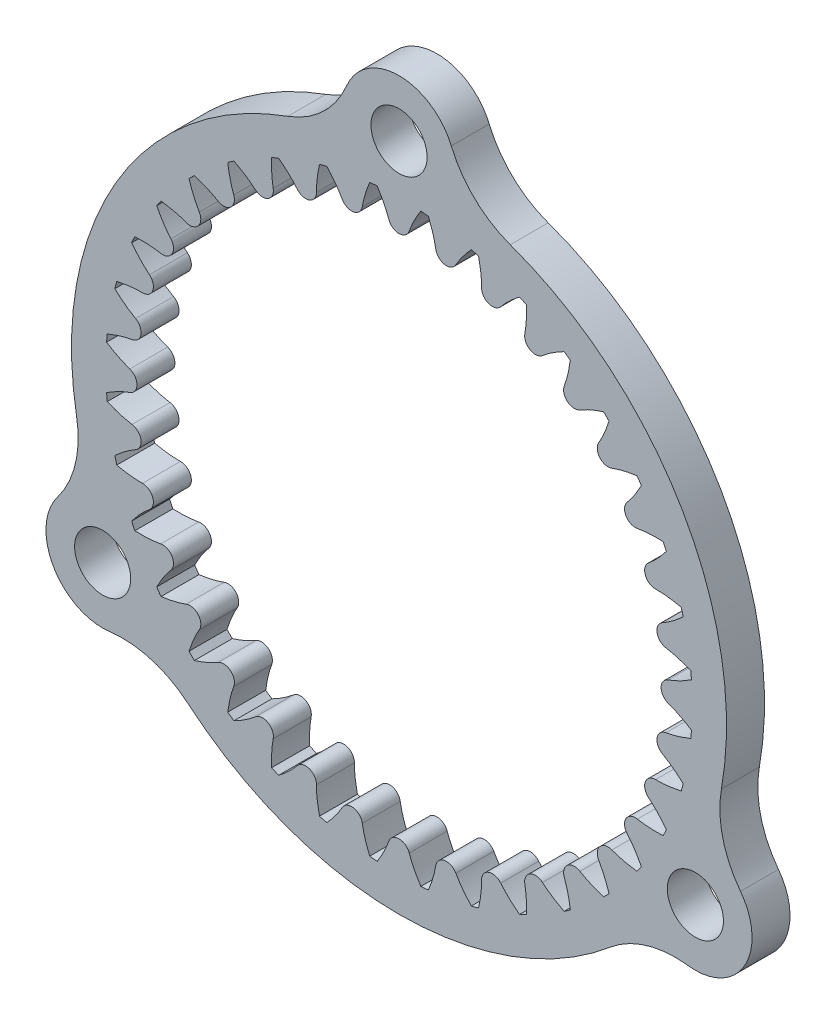
from build123d import *

# Parameters (mm, degrees)
SKETCH_1_R               = 36.406666664
SKETCH_1_R_2             = 32.59666666
EXTRUDE_1_DEPTH          = 4.22
EXTRUDE_2_DEPTH          = 4.22
PATTERN_CIRCULAR_1_COUNT = 36
FILLET_START             = -1
FILLET_1_DEPTH           = 6
PATTERN_CIRCULAR_2_COUNT = 36
EXTRUDE_3_DEPTH          = 4.22
FILLET_2_R               = 1.2
PATTERN_CIRCULAR_4_DEPTH = 4.22
PATTERN_CIRCULAR_8_COUNT = 3
SKETCH_5_R               = 3.12
CUT_EXTRUDE_1_DEPTH      = 10
PATTERN_CIRCULAR_9_COUNT = 3


with BuildPart() as part:
    # 草图1 → 凸台-拉伸1 (new body)
    with BuildSketch(Plane.XY):
        Circle(SKETCH_1_R)
        Circle(SKETCH_1_R_2, mode=Mode.SUBTRACT)
    extrude(amount=EXTRUDE_1_DEPTH)

    # 草图2 → 凸台-拉伸2 (add)
    with BuildSketch(Plane.XY):
        with BuildLine():
            ThreePointArc((0.836501753, 28.773540843), (0, 28.785697626), (-0.836501753, 28.773540843))
            add(Edge.make_bspline(
                [(-0.836501753, 28.773540843), (-0.846188353, 28.847595209), (-0.863798792, 28.953372202), (-0.89226802, 29.094073507), (-0.916024471, 29.200502204), (-0.944616842, 29.317566037), (-0.978480269, 29.445109526), (-1.01804375, 29.582964293), (-1.063732113, 29.730948947), (-1.115964959, 29.888869273), (-1.175156536, 30.056518351), (-1.241715329, 30.233676694), (-1.31604375, 30.420112401), (-1.398537793, 30.615581311), (-1.48958671, 30.819827171), (-1.589572688, 31.032581808), (-1.698870525, 31.25356531), (-1.817847315, 31.482486219), (-1.946862133, 31.719041726), (-2.086265761, 31.962917879), (-2.236400245, 32.213789796), (-2.455384739, 32.563640354), (-2.630772095, 32.825693461), (-2.753198749, 33.001206032)],
                knots=[0, 0, 0, 0, 0.04787327, 0.068728366, 0.09203189, 0.11778384, 0.145984218, 0.176633023, 0.209730255, 0.245275915, 0.283270001, 0.323712515, 0.366603456, 0.411942824, 0.459730619, 0.509966842, 0.562651491, 0.617784568, 0.675366072, 0.735396003, 0.797874362, 0.862801147, 1, 1, 1, 1], degree=3))
            ThreePointArc((-2.753198749, 33.001206032), (0, 33.115852743), (2.753198749, 33.001206032))
            add(Edge.make_bspline(
                [(0.836501753, 28.773540843), (0.846188353, 28.847595209), (0.863798792, 28.953372202), (0.89226802, 29.094073507), (0.916024471, 29.200502204), (0.944616842, 29.317566037), (0.978480269, 29.445109526), (1.01804375, 29.582964293), (1.063732113, 29.730948947), (1.115964959, 29.888869273), (1.175156536, 30.056518351), (1.241715329, 30.233676694), (1.31604375, 30.420112401), (1.398537793, 30.615581311), (1.48958671, 30.819827171), (1.589572688, 31.032581808), (1.698870525, 31.25356531), (1.817847315, 31.482486219), (1.946862133, 31.719041726), (2.086265761, 31.962917879), (2.236400245, 32.213789796), (2.455384739, 32.563640354), (2.630772095, 32.825693461), (2.753198749, 33.001206032)],
                knots=[0, 0, 0, 0, 0.04787327, 0.068728366, 0.09203189, 0.11778384, 0.145984218, 0.176633023, 0.209730255, 0.245275915, 0.283270001, 0.323712515, 0.366603456, 0.411942824, 0.459730619, 0.509966842, 0.562651491, 0.617784568, 0.675366072, 0.735396003, 0.797874362, 0.862801147, 1, 1, 1, 1], degree=3))
        make_face()
    extrude_2 = extrude(amount=EXTRUDE_2_DEPTH)

    # 阵列(圆周)1: 凸台-拉伸2 ×36 about axis
    pattern_circular_1_axis = Axis((0, 0, -0.211), (0, 0, 1))
    for i in range(1, PATTERN_CIRCULAR_1_COUNT):
        add(extrude_2.rotate(pattern_circular_1_axis, i * 360 / PATTERN_CIRCULAR_1_COUNT))

    # 圆角1: read off the stored shape, not the designer's step
    # 圆角1 outline → 圆角1 (cut)
    with BuildSketch(Plane.XY.offset(FILLET_START)):
        with BuildLine():
            ThreePointArc((-9.171394645, 28.387186586), (-9.343286246, 27.645141537), (-9.857475998, 27.083192718))
            ThreePointArc((-9.857475998, 27.083192718), (-10.612581938, 27.183155687), (-11.221235907, 27.641105381))
            add(Edge.make_bspline(
                [(-11.221235907, 27.641105381), (-11.202780791, 27.617765636), (-11.152648486, 27.55366216), (-11.074617887, 27.450701778), (-10.990291269, 27.334692178), (-10.914847613, 27.226422476), (-10.847941385, 27.126197623), (-10.789216865, 27.034312547), (-10.714341861, 26.911833618), (-10.661615599, 26.818458884), (-10.627185088, 26.752183555)],
                knots=[0.771193123, 0.771193123, 0.771193123, 0.771193123, 0.790269745, 0.823366977, 0.854015782, 0.88221616, 0.90796811, 0.931271634, 0.95212673, 1, 1, 1, 1], degree=3))
            ThreePointArc((-10.627185088, 26.752183555), (-9.845288428, 27.049707644), (-9.055076038, 27.324384454))
            add(Edge.make_bspline(
                [(-9.055076038, 27.324384454), (-9.071301697, 27.397285808), (-9.09093116, 27.502706791), (-9.112301516, 27.64465982), (-9.126378513, 27.752795265), (-9.139548662, 27.872578452), (-9.151349892, 28.004012102), (-9.161321488, 28.147084717), (-9.16772824, 28.276114047), (-9.170529586, 28.357444584), (-9.171394645, 28.387186586)],
                knots=[0, 0, 0, 0, 0.04787327, 0.068728366, 0.09203189, 0.11778384, 0.145984218, 0.176633023, 0.209730255, 0.228806877, 0.228806877, 0.228806877, 0.228806877], degree=3))
        make_face()
    fillet_1 = extrude(amount=FILLET_1_DEPTH, mode=Mode.SUBTRACT)

    # 阵列(圆周)2: 圆角1 ×36 about axis
    pattern_circular_2_axis = Axis((0, 0, 0), (0, 0, 1))
    for i in range(1, PATTERN_CIRCULAR_2_COUNT):
        add(fillet_1.rotate(pattern_circular_2_axis, i * 360 / PATTERN_CIRCULAR_2_COUNT), mode=Mode.SUBTRACT)

    # 草图4 → 凸台-拉伸3 (add)
    with BuildSketch(Plane.XY):
        with BuildLine():
            Line((-12.36497116, 34.242559276), (12.36497116, 34.242559276))
            ThreePointArc((12.36497116, 34.242559276), (8.43368382, 36.671147978), (5.810309696, 40.475220984))
            ThreePointArc((5.810309696, 40.475220984), (0, 44.34), (-5.810309696, 40.475220984))
            ThreePointArc((-5.810309696, 40.475220984), (-8.43368382, 36.671147978), (-12.36497116, 34.242559276))
        make_face()
    extrude_3 = extrude(amount=EXTRUDE_3_DEPTH)

    # 圆角2
    fillet_2_edges = [part.edges().sort_by_distance(p)[0] for p in [
        (-9.857475998, 27.083192718, 2.11),
    ]]
    fillet(fillet_2_edges, radius=FILLET_2_R)

    # 阵列(圆周)4: read off the stored shape, not the designer's step
    # 阵列(圆周)4 outline → 阵列(圆周)4 (cut)
    with BuildSketch(Plane.XY):
        with BuildLine():
            add(Edge.make_bspline(
                [(6.250932542, 29.169722048), (6.263124066, 29.192332015), (6.284161309, 29.230918999), (6.305493149, 29.269343531), (6.314406497, 29.285281571)],
                knots=[0.228806877, 0.228806877, 0.228806877, 0.228806877, 0.245275915, 0.256983722, 0.256983722, 0.256983722, 0.256983722], degree=3))
            ThreePointArc((6.314406497, 29.285281571), (5.058686752, 28.689238209), (4.082555011, 29.678817205))
            add(Edge.make_bspline(
                [(4.082555011, 29.678817205), (4.085479688, 29.660791802), (4.092383096, 29.617388634), (4.098954112, 29.573933569), (4.102677333, 29.548517403)],
                knots=[0.743016278, 0.743016278, 0.743016278, 0.743016278, 0.754724085, 0.771193123, 0.771193123, 0.771193123, 0.771193123], degree=3))
            ThreePointArc((4.102677333, 29.548517403), (4.400812285, 28.847594349), (5.004771727, 28.383470908))
            ThreePointArc((5.004771727, 28.383470908), (5.731047524, 28.613037986), (6.250932542, 29.169722048))
        make_face()
        with BuildLine():
            add(Edge.make_bspline(
                [(11.221235907, 27.641105381), (11.237168394, 27.661254817), (11.264586594, 27.695602499), (11.292266705, 27.729739041), (11.303812251, 27.743887159)],
                knots=[0.228806877, 0.228806877, 0.228806877, 0.228806877, 0.245275915, 0.256983722, 0.256983722, 0.256983722, 0.256983722], degree=3))
            ThreePointArc((11.303812251, 27.743887159), (9.963667868, 27.374952481), (9.17420435, 28.519001046))
            add(Edge.make_bspline(
                [(9.17420435, 28.519001046), (9.173954516, 28.500741625), (9.173216164, 28.456799084), (9.17214146, 28.412863154), (9.171394645, 28.387186586)],
                knots=[0.743016278, 0.743016278, 0.743016278, 0.743016278, 0.754724085, 0.771193123, 0.771193123, 0.771193123, 0.771193123], degree=3))
            ThreePointArc((9.171394645, 28.387186586), (9.343286246, 27.645141537), (9.857475998, 27.083192718))
            ThreePointArc((9.857475998, 27.083192718), (10.612581938, 27.183155687), (11.221235907, 27.641105381))
        make_face()
        with BuildLine():
            add(Edge.make_bspline(
                [(15.850587698, 25.272627715), (15.869777047, 25.289704388), (15.902743116, 25.318769131), (15.935930452, 25.347580461), (15.94975739, 25.359508775)],
                knots=[0.228806877, 0.228806877, 0.228806877, 0.228806877, 0.245275915, 0.256983722, 0.256983722, 0.256983722, 0.256983722], degree=3))
            ThreePointArc((15.94975739, 25.359508775), (14.565907976, 25.228892673), (13.987100132, 26.492649472))
            add(Edge.make_bspline(
                [(13.987100132, 26.492649472), (13.983683378, 26.474710835), (13.975325702, 26.431564094), (13.96663793, 26.388482269), (13.961443772, 26.363325469)],
                knots=[0.743016278, 0.743016278, 0.743016278, 0.743016278, 0.754724085, 0.771193123, 0.771193123, 0.771193123, 0.771193123], degree=3))
            ThreePointArc((13.961443772, 26.363325469), (14.001869183, 25.602705089), (14.410665849, 24.960005421))
            ThreePointArc((14.410665849, 24.960005421), (15.171658421, 24.927326958), (15.850587698, 25.272627715))
        make_face()
        with BuildLine():
            add(Edge.make_bspline(
                [(19.998327403, 22.136254044), (20.020190555, 22.149739088), (20.057702835, 22.172637775), (20.095389016, 22.195248476), (20.111077222, 22.204594549)],
                knots=[0.228806877, 0.228806877, 0.228806877, 0.228806877, 0.245275915, 0.256983722, 0.256983722, 0.256983722, 0.256983722], degree=3))
            ThreePointArc((20.111077222, 22.204594549), (18.725570342, 22.316265728), (18.375004954, 23.661332149))
            add(Edge.make_bspline(
                [(18.375004954, 23.661332149), (18.368525097, 23.644259353), (18.35280204, 23.603219403), (18.336765175, 23.562300704), (18.327281495, 23.538428048)],
                knots=[0.743016278, 0.743016278, 0.743016278, 0.743016278, 0.754724085, 0.771193123, 0.771193123, 0.771193123, 0.771193123], degree=3))
            ThreePointArc((18.327281495, 23.538428048), (18.23501241, 22.782343402), (18.52599491, 22.078420991))
            ThreePointArc((18.52599491, 22.078420991), (19.269751739, 21.914094013), (19.998327403, 22.136254044))
        make_face()
        with BuildLine():
            add(Edge.make_bspline(
                [(23.538428048, 18.327281495), (23.562300704, 18.336765175), (23.603219403, 18.35280204), (23.644259353, 18.368525097), (23.661332149, 18.375004954)],
                knots=[0.228806877, 0.228806877, 0.228806877, 0.228806877, 0.245275915, 0.256983722, 0.256983722, 0.256983722, 0.256983722], degree=3))
            ThreePointArc((23.661332149, 18.375004954), (22.316265728, 18.725570342), (22.204594549, 20.111077222))
            add(Edge.make_bspline(
                [(22.204594549, 20.111077222), (22.195248476, 20.095389016), (22.172637775, 20.057702835), (22.149739088, 20.020190555), (22.136254044, 19.998327403)],
                knots=[0.743016278, 0.743016278, 0.743016278, 0.743016278, 0.754724085, 0.771193123, 0.771193123, 0.771193123, 0.771193123], degree=3))
            ThreePointArc((22.136254044, 19.998327403), (21.914094013, 19.269751739), (22.078420991, 18.52599491))
            ThreePointArc((22.078420991, 18.52599491), (22.782343402, 18.23501241), (23.538428048, 18.327281495))
        make_face()
        with BuildLine():
            add(Edge.make_bspline(
                [(26.363325469, 13.961443772), (26.388482269, 13.96663793), (26.431564094, 13.975325702), (26.474710835, 13.983683378), (26.492649472, 13.987100132)],
                knots=[0.228806877, 0.228806877, 0.228806877, 0.228806877, 0.245275915, 0.256983722, 0.256983722, 0.256983722, 0.256983722], degree=3))
            ThreePointArc((26.492649472, 13.987100132), (25.228892673, 14.565907976), (25.359508775, 15.94975739))
            add(Edge.make_bspline(
                [(25.359508775, 15.94975739), (25.347580461, 15.935930452), (25.318769131, 15.902743116), (25.289704388, 15.869777047), (25.272627715, 15.850587698)],
                knots=[0.743016278, 0.743016278, 0.743016278, 0.743016278, 0.754724085, 0.771193123, 0.771193123, 0.771193123, 0.771193123], degree=3))
            ThreePointArc((25.272627715, 15.850587698), (24.927326958, 15.171658421), (24.960005421, 14.410665849))
            ThreePointArc((24.960005421, 14.410665849), (25.602705089, 14.001869183), (26.363325469, 13.961443772))
        make_face()
        with BuildLine():
            add(Edge.make_bspline(
                [(28.387186586, 9.171394645), (28.412863154, 9.17214146), (28.456799084, 9.173216164), (28.500741625, 9.173954516), (28.519001046, 9.17420435)],
                knots=[0.228806877, 0.228806877, 0.228806877, 0.228806877, 0.245275915, 0.256983722, 0.256983722, 0.256983722, 0.256983722], degree=3))
            ThreePointArc((28.519001046, 9.17420435), (27.374952481, 9.963667868), (27.743887159, 11.303812251))
            add(Edge.make_bspline(
                [(27.743887159, 11.303812251), (27.729739041, 11.292266705), (27.695602499, 11.264586594), (27.661254816, 11.237168394), (27.641105381, 11.221235907)],
                knots=[0.743016278, 0.743016278, 0.743016278, 0.743016278, 0.754724085, 0.771193123, 0.771193123, 0.771193123, 0.771193123], degree=3))
            ThreePointArc((27.641105381, 11.221235907), (27.183155687, 10.612581938), (27.083192718, 9.857475998))
            ThreePointArc((27.083192718, 9.857475998), (27.645141537, 9.343286246), (28.387186586, 9.171394645))
        make_face()
        with BuildLine():
            add(Edge.make_bspline(
                [(29.548517403, 4.102677333), (29.573933569, 4.098954112), (29.617388634, 4.092383096), (29.660791802, 4.085479688), (29.678817205, 4.082555011)],
                knots=[0.228806877, 0.228806877, 0.228806877, 0.228806877, 0.245275915, 0.256983722, 0.256983722, 0.256983722, 0.256983722], degree=3))
            ThreePointArc((29.678817205, 4.082555011), (28.689238209, 5.058686752), (29.285281571, 6.314406497))
            add(Edge.make_bspline(
                [(29.285281571, 6.314406497), (29.269343531, 6.305493149), (29.230918999, 6.284161309), (29.192332015, 6.263124066), (29.169722048, 6.250932542)],
                knots=[0.743016278, 0.743016278, 0.743016278, 0.743016278, 0.754724085, 0.771193123, 0.771193123, 0.771193123, 0.771193123], degree=3))
            ThreePointArc((29.169722048, 6.250932542), (28.613037986, 5.731047524), (28.383470908, 5.004771727))
            ThreePointArc((28.383470908, 5.004771727), (28.847594349, 4.400812285), (29.548517403, 4.102677333))
        make_face()
        with BuildLine():
            add(Edge.make_bspline(
                [(29.812031471, -1.090697754), (29.836414978, -1.098777882), (29.878068818, -1.112794963), (29.91961383, -1.127130374), (29.936857522, -1.133140697)],
                knots=[0.228806877, 0.228806877, 0.228806877, 0.228806877, 0.245275915, 0.256983722, 0.256983722, 0.256983722, 0.256983722], degree=3))
            ThreePointArc((29.936857522, -1.133140697), (29.131815952, 0), (29.936857522, 1.133140697))
            add(Edge.make_bspline(
                [(29.936857522, 1.133140697), (29.91961383, 1.127130374), (29.878068818, 1.112794963), (29.836414978, 1.098777882), (29.812031471, 1.090697754)],
                knots=[0.743016278, 0.743016278, 0.743016278, 0.743016278, 0.754724085, 0.771193123, 0.771193123, 0.771193123, 0.771193123], degree=3))
            ThreePointArc((29.812031471, 1.090697754), (29.173527604, 0.675378131), (28.821331698, 0))
            ThreePointArc((28.821331698, 0), (29.173527604, -0.675378131), (29.812031471, -1.090697754))
        make_face()
        with BuildLine():
            add(Edge.make_bspline(
                [(29.169722048, -6.250932542), (29.192332015, -6.263124066), (29.230918999, -6.284161309), (29.269343531, -6.305493149), (29.285281571, -6.314406497)],
                knots=[0.228806877, 0.228806877, 0.228806877, 0.228806877, 0.245275915, 0.256983722, 0.256983722, 0.256983722, 0.256983722], degree=3))
            ThreePointArc((29.285281571, -6.314406497), (28.689238209, -5.058686752), (29.678817205, -4.082555011))
            add(Edge.make_bspline(
                [(29.678817205, -4.082555011), (29.660791802, -4.085479688), (29.617388634, -4.092383096), (29.573933569, -4.098954112), (29.548517403, -4.102677333)],
                knots=[0.743016278, 0.743016278, 0.743016278, 0.743016278, 0.754724085, 0.771193123, 0.771193123, 0.771193123, 0.771193123], degree=3))
            ThreePointArc((29.548517403, -4.102677333), (28.847594349, -4.400812285), (28.383470908, -5.004771727))
            ThreePointArc((28.383470908, -5.004771727), (28.613037986, -5.731047524), (29.169722048, -6.250932542))
        make_face()
        with BuildLine():
            add(Edge.make_bspline(
                [(27.641105381, -11.221235907), (27.661254817, -11.237168394), (27.695602499, -11.264586594), (27.729739041, -11.292266705), (27.743887159, -11.303812251)],
                knots=[0.228806877, 0.228806877, 0.228806877, 0.228806877, 0.245275915, 0.256983722, 0.256983722, 0.256983722, 0.256983722], degree=3))
            ThreePointArc((27.743887159, -11.303812251), (27.374952481, -9.963667868), (28.519001046, -9.17420435))
            add(Edge.make_bspline(
                [(28.519001046, -9.17420435), (28.500741625, -9.173954516), (28.456799084, -9.173216164), (28.412863154, -9.17214146), (28.387186586, -9.171394645)],
                knots=[0.743016278, 0.743016278, 0.743016278, 0.743016278, 0.754724085, 0.771193123, 0.771193123, 0.771193123, 0.771193123], degree=3))
            ThreePointArc((28.387186586, -9.171394645), (27.645141537, -9.343286246), (27.083192718, -9.857475998))
            ThreePointArc((27.083192718, -9.857475998), (27.183155687, -10.612581938), (27.641105381, -11.221235907))
        make_face()
        with BuildLine():
            add(Edge.make_bspline(
                [(25.272627715, -15.850587698), (25.289704388, -15.869777047), (25.318769131, -15.902743116), (25.347580461, -15.935930452), (25.359508775, -15.94975739)],
                knots=[0.228806877, 0.228806877, 0.228806877, 0.228806877, 0.245275915, 0.256983722, 0.256983722, 0.256983722, 0.256983722], degree=3))
            ThreePointArc((25.359508775, -15.94975739), (25.228892673, -14.565907976), (26.492649472, -13.987100132))
            add(Edge.make_bspline(
                [(26.492649472, -13.987100132), (26.474710835, -13.983683378), (26.431564094, -13.975325702), (26.388482269, -13.96663793), (26.363325469, -13.961443772)],
                knots=[0.743016278, 0.743016278, 0.743016278, 0.743016278, 0.754724085, 0.771193123, 0.771193123, 0.771193123, 0.771193123], degree=3))
            ThreePointArc((26.363325469, -13.961443772), (25.602705089, -14.001869183), (24.960005421, -14.410665849))
            ThreePointArc((24.960005421, -14.410665849), (24.927326958, -15.171658421), (25.272627715, -15.850587698))
        make_face()
        with BuildLine():
            add(Edge.make_bspline(
                [(22.136254044, -19.998327403), (22.149739088, -20.020190555), (22.172637775, -20.057702835), (22.195248476, -20.095389016), (22.204594549, -20.111077222)],
                knots=[0.228806877, 0.228806877, 0.228806877, 0.228806877, 0.245275915, 0.256983722, 0.256983722, 0.256983722, 0.256983722], degree=3))
            ThreePointArc((22.204594549, -20.111077222), (22.316265728, -18.725570342), (23.661332149, -18.375004954))
            add(Edge.make_bspline(
                [(23.661332149, -18.375004954), (23.644259353, -18.368525097), (23.603219403, -18.35280204), (23.562300704, -18.336765175), (23.538428048, -18.327281495)],
                knots=[0.743016278, 0.743016278, 0.743016278, 0.743016278, 0.754724085, 0.771193123, 0.771193123, 0.771193123, 0.771193123], degree=3))
            ThreePointArc((23.538428048, -18.327281495), (22.782343402, -18.23501241), (22.078420991, -18.52599491))
            ThreePointArc((22.078420991, -18.52599491), (21.914094013, -19.269751739), (22.136254044, -19.998327403))
        make_face()
        with BuildLine():
            add(Edge.make_bspline(
                [(18.327281495, -23.538428048), (18.336765175, -23.562300704), (18.35280204, -23.603219403), (18.368525097, -23.644259353), (18.375004954, -23.661332149)],
                knots=[0.228806877, 0.228806877, 0.228806877, 0.228806877, 0.245275915, 0.256983722, 0.256983722, 0.256983722, 0.256983722], degree=3))
            ThreePointArc((18.375004954, -23.661332149), (18.725570342, -22.316265728), (20.111077222, -22.204594549))
            add(Edge.make_bspline(
                [(20.111077222, -22.204594549), (20.095389016, -22.195248476), (20.057702835, -22.172637775), (20.020190555, -22.149739088), (19.998327403, -22.136254044)],
                knots=[0.743016278, 0.743016278, 0.743016278, 0.743016278, 0.754724085, 0.771193123, 0.771193123, 0.771193123, 0.771193123], degree=3))
            ThreePointArc((19.998327403, -22.136254044), (19.269751739, -21.914094013), (18.52599491, -22.078420991))
            ThreePointArc((18.52599491, -22.078420991), (18.23501241, -22.782343402), (18.327281495, -23.538428048))
        make_face()
        with BuildLine():
            add(Edge.make_bspline(
                [(13.961443772, -26.363325469), (13.96663793, -26.388482269), (13.975325702, -26.431564094), (13.983683378, -26.474710835), (13.987100132, -26.492649472)],
                knots=[0.228806877, 0.228806877, 0.228806877, 0.228806877, 0.245275915, 0.256983722, 0.256983722, 0.256983722, 0.256983722], degree=3))
            ThreePointArc((13.987100132, -26.492649472), (14.565907976, -25.228892673), (15.94975739, -25.359508775))
            add(Edge.make_bspline(
                [(15.94975739, -25.359508775), (15.935930452, -25.347580461), (15.902743116, -25.318769131), (15.869777047, -25.289704388), (15.850587698, -25.272627715)],
                knots=[0.743016278, 0.743016278, 0.743016278, 0.743016278, 0.754724085, 0.771193123, 0.771193123, 0.771193123, 0.771193123], degree=3))
            ThreePointArc((15.850587698, -25.272627715), (15.171658421, -24.927326958), (14.410665849, -24.960005421))
            ThreePointArc((14.410665849, -24.960005421), (14.001869183, -25.602705089), (13.961443772, -26.363325469))
        make_face()
        with BuildLine():
            add(Edge.make_bspline(
                [(9.171394645, -28.387186586), (9.17214146, -28.412863154), (9.173216164, -28.456799084), (9.173954516, -28.500741625), (9.17420435, -28.519001046)],
                knots=[0.228806877, 0.228806877, 0.228806877, 0.228806877, 0.245275915, 0.256983722, 0.256983722, 0.256983722, 0.256983722], degree=3))
            ThreePointArc((9.17420435, -28.519001046), (9.963667868, -27.374952481), (11.303812251, -27.743887159))
            add(Edge.make_bspline(
                [(11.303812251, -27.743887159), (11.292266705, -27.729739041), (11.264586594, -27.695602499), (11.237168394, -27.661254816), (11.221235907, -27.641105381)],
                knots=[0.743016278, 0.743016278, 0.743016278, 0.743016278, 0.754724085, 0.771193123, 0.771193123, 0.771193123, 0.771193123], degree=3))
            ThreePointArc((11.221235907, -27.641105381), (10.612581938, -27.183155687), (9.857475998, -27.083192718))
            ThreePointArc((9.857475998, -27.083192718), (9.343286246, -27.645141537), (9.171394645, -28.387186586))
        make_face()
        with BuildLine():
            add(Edge.make_bspline(
                [(4.102677333, -29.548517403), (4.098954112, -29.573933569), (4.092383096, -29.617388634), (4.085479688, -29.660791802), (4.082555011, -29.678817205)],
                knots=[0.228806877, 0.228806877, 0.228806877, 0.228806877, 0.245275915, 0.256983722, 0.256983722, 0.256983722, 0.256983722], degree=3))
            ThreePointArc((4.082555011, -29.678817205), (5.058686752, -28.689238209), (6.314406497, -29.285281571))
            add(Edge.make_bspline(
                [(6.314406497, -29.285281571), (6.305493149, -29.269343531), (6.284161309, -29.230918999), (6.263124066, -29.192332015), (6.250932542, -29.169722048)],
                knots=[0.743016278, 0.743016278, 0.743016278, 0.743016278, 0.754724085, 0.771193123, 0.771193123, 0.771193123, 0.771193123], degree=3))
            ThreePointArc((6.250932542, -29.169722048), (5.731047524, -28.613037986), (5.004771727, -28.383470908))
            ThreePointArc((5.004771727, -28.383470908), (4.400812285, -28.847594349), (4.102677333, -29.548517403))
        make_face()
        with BuildLine():
            add(Edge.make_bspline(
                [(-1.090697754, -29.812031471), (-1.098777882, -29.836414978), (-1.112794963, -29.878068818), (-1.127130374, -29.91961383), (-1.133140697, -29.936857522)],
                knots=[0.228806877, 0.228806877, 0.228806877, 0.228806877, 0.245275915, 0.256983722, 0.256983722, 0.256983722, 0.256983722], degree=3))
            ThreePointArc((-1.133140697, -29.936857522), (0, -29.131815952), (1.133140697, -29.936857522))
            add(Edge.make_bspline(
                [(1.133140697, -29.936857522), (1.127130374, -29.91961383), (1.112794963, -29.878068818), (1.098777882, -29.836414978), (1.090697754, -29.812031471)],
                knots=[0.743016278, 0.743016278, 0.743016278, 0.743016278, 0.754724085, 0.771193123, 0.771193123, 0.771193123, 0.771193123], degree=3))
            ThreePointArc((1.090697754, -29.812031471), (0.675378131, -29.173527604), (0, -28.821331698))
            ThreePointArc((0, -28.821331698), (-0.675378131, -29.173527604), (-1.090697754, -29.812031471))
        make_face()
        with BuildLine():
            add(Edge.make_bspline(
                [(-6.250932542, -29.169722048), (-6.263124066, -29.192332015), (-6.284161309, -29.230918999), (-6.305493149, -29.269343531), (-6.314406497, -29.285281571)],
                knots=[0.228806877, 0.228806877, 0.228806877, 0.228806877, 0.245275915, 0.256983722, 0.256983722, 0.256983722, 0.256983722], degree=3))
            ThreePointArc((-6.314406497, -29.285281571), (-5.058686752, -28.689238209), (-4.082555011, -29.678817205))
            add(Edge.make_bspline(
                [(-4.082555011, -29.678817205), (-4.085479688, -29.660791802), (-4.092383096, -29.617388634), (-4.098954112, -29.573933569), (-4.102677333, -29.548517403)],
                knots=[0.743016278, 0.743016278, 0.743016278, 0.743016278, 0.754724085, 0.771193123, 0.771193123, 0.771193123, 0.771193123], degree=3))
            ThreePointArc((-4.102677333, -29.548517403), (-4.400812285, -28.847594349), (-5.004771727, -28.383470908))
            ThreePointArc((-5.004771727, -28.383470908), (-5.731047524, -28.613037986), (-6.250932542, -29.169722048))
        make_face()
        with BuildLine():
            add(Edge.make_bspline(
                [(-11.221235907, -27.641105381), (-11.237168394, -27.661254817), (-11.264586594, -27.695602499), (-11.292266705, -27.729739041), (-11.303812251, -27.743887159)],
                knots=[0.228806877, 0.228806877, 0.228806877, 0.228806877, 0.245275915, 0.256983722, 0.256983722, 0.256983722, 0.256983722], degree=3))
            ThreePointArc((-11.303812251, -27.743887159), (-9.963667868, -27.374952481), (-9.17420435, -28.519001046))
            add(Edge.make_bspline(
                [(-9.17420435, -28.519001046), (-9.173954516, -28.500741625), (-9.173216164, -28.456799084), (-9.17214146, -28.412863154), (-9.171394645, -28.387186586)],
                knots=[0.743016278, 0.743016278, 0.743016278, 0.743016278, 0.754724085, 0.771193123, 0.771193123, 0.771193123, 0.771193123], degree=3))
            ThreePointArc((-9.171394645, -28.387186586), (-9.343286246, -27.645141537), (-9.857475998, -27.083192718))
            ThreePointArc((-9.857475998, -27.083192718), (-10.612581938, -27.183155687), (-11.221235907, -27.641105381))
        make_face()
        with BuildLine():
            add(Edge.make_bspline(
                [(-15.850587698, -25.272627715), (-15.869777047, -25.289704388), (-15.902743116, -25.318769131), (-15.935930452, -25.347580461), (-15.94975739, -25.359508775)],
                knots=[0.228806877, 0.228806877, 0.228806877, 0.228806877, 0.245275915, 0.256983722, 0.256983722, 0.256983722, 0.256983722], degree=3))
            ThreePointArc((-15.94975739, -25.359508775), (-14.565907976, -25.228892673), (-13.987100132, -26.492649472))
            add(Edge.make_bspline(
                [(-13.987100132, -26.492649472), (-13.983683378, -26.474710835), (-13.975325702, -26.431564094), (-13.96663793, -26.388482269), (-13.961443772, -26.363325469)],
                knots=[0.743016278, 0.743016278, 0.743016278, 0.743016278, 0.754724085, 0.771193123, 0.771193123, 0.771193123, 0.771193123], degree=3))
            ThreePointArc((-13.961443772, -26.363325469), (-14.001869183, -25.602705089), (-14.410665849, -24.960005421))
            ThreePointArc((-14.410665849, -24.960005421), (-15.171658421, -24.927326958), (-15.850587698, -25.272627715))
        make_face()
        with BuildLine():
            add(Edge.make_bspline(
                [(-19.998327403, -22.136254044), (-20.020190555, -22.149739088), (-20.057702835, -22.172637775), (-20.095389016, -22.195248476), (-20.111077222, -22.204594549)],
                knots=[0.228806877, 0.228806877, 0.228806877, 0.228806877, 0.245275915, 0.256983722, 0.256983722, 0.256983722, 0.256983722], degree=3))
            ThreePointArc((-20.111077222, -22.204594549), (-18.725570342, -22.316265728), (-18.375004954, -23.661332149))
            add(Edge.make_bspline(
                [(-18.375004954, -23.661332149), (-18.368525097, -23.644259353), (-18.35280204, -23.603219403), (-18.336765175, -23.562300704), (-18.327281495, -23.538428048)],
                knots=[0.743016278, 0.743016278, 0.743016278, 0.743016278, 0.754724085, 0.771193123, 0.771193123, 0.771193123, 0.771193123], degree=3))
            ThreePointArc((-18.327281495, -23.538428048), (-18.23501241, -22.782343402), (-18.52599491, -22.078420991))
            ThreePointArc((-18.52599491, -22.078420991), (-19.269751739, -21.914094013), (-19.998327403, -22.136254044))
        make_face()
        with BuildLine():
            add(Edge.make_bspline(
                [(-23.538428048, -18.327281495), (-23.562300704, -18.336765175), (-23.603219403, -18.35280204), (-23.644259353, -18.368525097), (-23.661332149, -18.375004954)],
                knots=[0.228806877, 0.228806877, 0.228806877, 0.228806877, 0.245275915, 0.256983722, 0.256983722, 0.256983722, 0.256983722], degree=3))
            ThreePointArc((-23.661332149, -18.375004954), (-22.316265728, -18.725570342), (-22.204594549, -20.111077222))
            add(Edge.make_bspline(
                [(-22.204594549, -20.111077222), (-22.195248476, -20.095389016), (-22.172637775, -20.057702835), (-22.149739088, -20.020190555), (-22.136254044, -19.998327403)],
                knots=[0.743016278, 0.743016278, 0.743016278, 0.743016278, 0.754724085, 0.771193123, 0.771193123, 0.771193123, 0.771193123], degree=3))
            ThreePointArc((-22.136254044, -19.998327403), (-21.914094013, -19.269751739), (-22.078420991, -18.52599491))
            ThreePointArc((-22.078420991, -18.52599491), (-22.782343402, -18.23501241), (-23.538428048, -18.327281495))
        make_face()
        with BuildLine():
            add(Edge.make_bspline(
                [(-26.363325469, -13.961443772), (-26.388482269, -13.96663793), (-26.431564094, -13.975325702), (-26.474710835, -13.983683378), (-26.492649472, -13.987100132)],
                knots=[0.228806877, 0.228806877, 0.228806877, 0.228806877, 0.245275915, 0.256983722, 0.256983722, 0.256983722, 0.256983722], degree=3))
            ThreePointArc((-26.492649472, -13.987100132), (-25.228892673, -14.565907976), (-25.359508775, -15.94975739))
            add(Edge.make_bspline(
                [(-25.359508775, -15.94975739), (-25.347580461, -15.935930452), (-25.318769131, -15.902743116), (-25.289704388, -15.869777047), (-25.272627715, -15.850587698)],
                knots=[0.743016278, 0.743016278, 0.743016278, 0.743016278, 0.754724085, 0.771193123, 0.771193123, 0.771193123, 0.771193123], degree=3))
            ThreePointArc((-25.272627715, -15.850587698), (-24.927326958, -15.171658421), (-24.960005421, -14.410665849))
            ThreePointArc((-24.960005421, -14.410665849), (-25.602705089, -14.001869183), (-26.363325469, -13.961443772))
        make_face()
        with BuildLine():
            add(Edge.make_bspline(
                [(-28.387186586, -9.171394645), (-28.412863154, -9.17214146), (-28.456799084, -9.173216164), (-28.500741625, -9.173954516), (-28.519001046, -9.17420435)],
                knots=[0.228806877, 0.228806877, 0.228806877, 0.228806877, 0.245275915, 0.256983722, 0.256983722, 0.256983722, 0.256983722], degree=3))
            ThreePointArc((-28.519001046, -9.17420435), (-27.374952481, -9.963667868), (-27.743887159, -11.303812251))
            add(Edge.make_bspline(
                [(-27.743887159, -11.303812251), (-27.729739041, -11.292266705), (-27.695602499, -11.264586594), (-27.661254816, -11.237168394), (-27.641105381, -11.221235907)],
                knots=[0.743016278, 0.743016278, 0.743016278, 0.743016278, 0.754724085, 0.771193123, 0.771193123, 0.771193123, 0.771193123], degree=3))
            ThreePointArc((-27.641105381, -11.221235907), (-27.183155687, -10.612581938), (-27.083192718, -9.857475998))
            ThreePointArc((-27.083192718, -9.857475998), (-27.645141537, -9.343286246), (-28.387186586, -9.171394645))
        make_face()
        with BuildLine():
            add(Edge.make_bspline(
                [(-29.548517403, -4.102677333), (-29.573933569, -4.098954112), (-29.617388634, -4.092383096), (-29.660791802, -4.085479688), (-29.678817205, -4.082555011)],
                knots=[0.228806877, 0.228806877, 0.228806877, 0.228806877, 0.245275915, 0.256983722, 0.256983722, 0.256983722, 0.256983722], degree=3))
            ThreePointArc((-29.678817205, -4.082555011), (-28.689238209, -5.058686752), (-29.285281571, -6.314406497))
            add(Edge.make_bspline(
                [(-29.285281571, -6.314406497), (-29.269343531, -6.305493149), (-29.230918999, -6.284161309), (-29.192332015, -6.263124066), (-29.169722048, -6.250932542)],
                knots=[0.743016278, 0.743016278, 0.743016278, 0.743016278, 0.754724085, 0.771193123, 0.771193123, 0.771193123, 0.771193123], degree=3))
            ThreePointArc((-29.169722048, -6.250932542), (-28.613037986, -5.731047524), (-28.383470908, -5.004771727))
            ThreePointArc((-28.383470908, -5.004771727), (-28.847594349, -4.400812285), (-29.548517403, -4.102677333))
        make_face()
        with BuildLine():
            add(Edge.make_bspline(
                [(-29.812031471, 1.090697754), (-29.836414978, 1.098777882), (-29.878068818, 1.112794963), (-29.91961383, 1.127130374), (-29.936857522, 1.133140697)],
                knots=[0.228806877, 0.228806877, 0.228806877, 0.228806877, 0.245275915, 0.256983722, 0.256983722, 0.256983722, 0.256983722], degree=3))
            ThreePointArc((-29.936857522, 1.133140697), (-29.131815952, 0), (-29.936857522, -1.133140697))
            add(Edge.make_bspline(
                [(-29.936857522, -1.133140697), (-29.91961383, -1.127130374), (-29.878068818, -1.112794963), (-29.836414978, -1.098777882), (-29.812031471, -1.090697754)],
                knots=[0.743016278, 0.743016278, 0.743016278, 0.743016278, 0.754724085, 0.771193123, 0.771193123, 0.771193123, 0.771193123], degree=3))
            ThreePointArc((-29.812031471, -1.090697754), (-29.173527604, -0.675378131), (-28.821331698, 0))
            ThreePointArc((-28.821331698, 0), (-29.173527604, 0.675378131), (-29.812031471, 1.090697754))
        make_face()
        with BuildLine():
            add(Edge.make_bspline(
                [(-29.169722048, 6.250932542), (-29.192332015, 6.263124066), (-29.230918999, 6.284161309), (-29.269343531, 6.305493149), (-29.285281571, 6.314406497)],
                knots=[0.228806877, 0.228806877, 0.228806877, 0.228806877, 0.245275915, 0.256983722, 0.256983722, 0.256983722, 0.256983722], degree=3))
            ThreePointArc((-29.285281571, 6.314406497), (-28.689238209, 5.058686752), (-29.678817205, 4.082555011))
            add(Edge.make_bspline(
                [(-29.678817205, 4.082555011), (-29.660791802, 4.085479688), (-29.617388634, 4.092383096), (-29.573933569, 4.098954112), (-29.548517403, 4.102677333)],
                knots=[0.743016278, 0.743016278, 0.743016278, 0.743016278, 0.754724085, 0.771193123, 0.771193123, 0.771193123, 0.771193123], degree=3))
            ThreePointArc((-29.548517403, 4.102677333), (-28.847594349, 4.400812285), (-28.383470908, 5.004771727))
            ThreePointArc((-28.383470908, 5.004771727), (-28.613037986, 5.731047524), (-29.169722048, 6.250932542))
        make_face()
        with BuildLine():
            add(Edge.make_bspline(
                [(-27.641105381, 11.221235907), (-27.661254816, 11.237168394), (-27.695602499, 11.264586594), (-27.729739041, 11.292266705), (-27.743887159, 11.303812251)],
                knots=[0.228806877, 0.228806877, 0.228806877, 0.228806877, 0.245275915, 0.256983722, 0.256983722, 0.256983722, 0.256983722], degree=3))
            ThreePointArc((-27.743887159, 11.303812251), (-27.374952481, 9.963667868), (-28.519001046, 9.17420435))
            add(Edge.make_bspline(
                [(-28.519001046, 9.17420435), (-28.500741625, 9.173954516), (-28.456799084, 9.173216164), (-28.412863154, 9.17214146), (-28.387186586, 9.171394645)],
                knots=[0.743016278, 0.743016278, 0.743016278, 0.743016278, 0.754724085, 0.771193123, 0.771193123, 0.771193123, 0.771193123], degree=3))
            ThreePointArc((-28.387186586, 9.171394645), (-27.645141537, 9.343286246), (-27.083192718, 9.857475998))
            ThreePointArc((-27.083192718, 9.857475998), (-27.183155687, 10.612581938), (-27.641105381, 11.221235907))
        make_face()
        with BuildLine():
            add(Edge.make_bspline(
                [(-25.272627715, 15.850587698), (-25.289704388, 15.869777047), (-25.318769131, 15.902743116), (-25.347580461, 15.935930452), (-25.359508775, 15.94975739)],
                knots=[0.228806877, 0.228806877, 0.228806877, 0.228806877, 0.245275915, 0.256983722, 0.256983722, 0.256983722, 0.256983722], degree=3))
            ThreePointArc((-25.359508775, 15.94975739), (-25.228892673, 14.565907976), (-26.492649472, 13.987100132))
            add(Edge.make_bspline(
                [(-26.492649472, 13.987100132), (-26.474710835, 13.983683378), (-26.431564094, 13.975325702), (-26.388482269, 13.96663793), (-26.363325469, 13.961443772)],
                knots=[0.743016278, 0.743016278, 0.743016278, 0.743016278, 0.754724085, 0.771193123, 0.771193123, 0.771193123, 0.771193123], degree=3))
            ThreePointArc((-26.363325469, 13.961443772), (-25.602705089, 14.001869183), (-24.960005421, 14.410665849))
            ThreePointArc((-24.960005421, 14.410665849), (-24.927326958, 15.171658421), (-25.272627715, 15.850587698))
        make_face()
        with BuildLine():
            add(Edge.make_bspline(
                [(-22.136254044, 19.998327403), (-22.149739088, 20.020190555), (-22.172637775, 20.057702835), (-22.195248476, 20.095389016), (-22.204594549, 20.111077222)],
                knots=[0.228806877, 0.228806877, 0.228806877, 0.228806877, 0.245275915, 0.256983722, 0.256983722, 0.256983722, 0.256983722], degree=3))
            ThreePointArc((-22.204594549, 20.111077222), (-22.316265728, 18.725570342), (-23.661332149, 18.375004954))
            add(Edge.make_bspline(
                [(-23.661332149, 18.375004954), (-23.644259353, 18.368525097), (-23.603219403, 18.35280204), (-23.562300704, 18.336765175), (-23.538428048, 18.327281495)],
                knots=[0.743016278, 0.743016278, 0.743016278, 0.743016278, 0.754724085, 0.771193123, 0.771193123, 0.771193123, 0.771193123], degree=3))
            ThreePointArc((-23.538428048, 18.327281495), (-22.782343402, 18.23501241), (-22.078420991, 18.52599491))
            ThreePointArc((-22.078420991, 18.52599491), (-21.914094013, 19.269751739), (-22.136254044, 19.998327403))
        make_face()
        with BuildLine():
            add(Edge.make_bspline(
                [(-18.327281495, 23.538428048), (-18.336765175, 23.562300704), (-18.35280204, 23.603219403), (-18.368525097, 23.644259353), (-18.375004954, 23.661332149)],
                knots=[0.228806877, 0.228806877, 0.228806877, 0.228806877, 0.245275915, 0.256983722, 0.256983722, 0.256983722, 0.256983722], degree=3))
            ThreePointArc((-18.375004954, 23.661332149), (-18.725570342, 22.316265728), (-20.111077222, 22.204594549))
            add(Edge.make_bspline(
                [(-20.111077222, 22.204594549), (-20.095389016, 22.195248476), (-20.057702835, 22.172637775), (-20.020190555, 22.149739088), (-19.998327403, 22.136254044)],
                knots=[0.743016278, 0.743016278, 0.743016278, 0.743016278, 0.754724085, 0.771193123, 0.771193123, 0.771193123, 0.771193123], degree=3))
            ThreePointArc((-19.998327403, 22.136254044), (-19.269751739, 21.914094013), (-18.52599491, 22.078420991))
            ThreePointArc((-18.52599491, 22.078420991), (-18.23501241, 22.782343402), (-18.327281495, 23.538428048))
        make_face()
        with BuildLine():
            add(Edge.make_bspline(
                [(-13.961443772, 26.363325469), (-13.96663793, 26.388482269), (-13.975325702, 26.431564094), (-13.983683378, 26.474710835), (-13.987100132, 26.492649472)],
                knots=[0.228806877, 0.228806877, 0.228806877, 0.228806877, 0.245275915, 0.256983722, 0.256983722, 0.256983722, 0.256983722], degree=3))
            ThreePointArc((-13.987100132, 26.492649472), (-14.565907976, 25.228892673), (-15.94975739, 25.359508775))
            add(Edge.make_bspline(
                [(-15.94975739, 25.359508775), (-15.935930452, 25.347580461), (-15.902743116, 25.318769131), (-15.869777047, 25.289704388), (-15.850587698, 25.272627715)],
                knots=[0.743016278, 0.743016278, 0.743016278, 0.743016278, 0.754724085, 0.771193123, 0.771193123, 0.771193123, 0.771193123], degree=3))
            ThreePointArc((-15.850587698, 25.272627715), (-15.171658421, 24.927326958), (-14.410665849, 24.960005421))
            ThreePointArc((-14.410665849, 24.960005421), (-14.001869183, 25.602705089), (-13.961443772, 26.363325469))
        make_face()
        with BuildLine():
            add(Edge.make_bspline(
                [(-4.102677333, 29.548517403), (-4.098954112, 29.573933569), (-4.092383096, 29.617388634), (-4.085479688, 29.660791802), (-4.082555011, 29.678817205)],
                knots=[0.228806877, 0.228806877, 0.228806877, 0.228806877, 0.245275915, 0.256983722, 0.256983722, 0.256983722, 0.256983722], degree=3))
            ThreePointArc((-4.082555011, 29.678817205), (-5.058686752, 28.689238209), (-6.314406497, 29.285281571))
            add(Edge.make_bspline(
                [(-6.314406497, 29.285281571), (-6.305493149, 29.269343531), (-6.284161309, 29.230918999), (-6.263124066, 29.192332015), (-6.250932542, 29.169722048)],
                knots=[0.743016278, 0.743016278, 0.743016278, 0.743016278, 0.754724085, 0.771193123, 0.771193123, 0.771193123, 0.771193123], degree=3))
            ThreePointArc((-6.250932542, 29.169722048), (-5.731047524, 28.613037986), (-5.004771727, 28.383470908))
            ThreePointArc((-5.004771727, 28.383470908), (-4.400812285, 28.847594349), (-4.102677333, 29.548517403))
        make_face()
        with BuildLine():
            add(Edge.make_bspline(
                [(1.090697754, 29.812031471), (1.098777882, 29.836414978), (1.112794963, 29.878068818), (1.127130374, 29.91961383), (1.133140697, 29.936857522)],
                knots=[0.228806877, 0.228806877, 0.228806877, 0.228806877, 0.245275915, 0.256983722, 0.256983722, 0.256983722, 0.256983722], degree=3))
            ThreePointArc((1.133140697, 29.936857522), (0, 29.131815952), (-1.133140697, 29.936857522))
            add(Edge.make_bspline(
                [(-1.133140697, 29.936857522), (-1.127130374, 29.91961383), (-1.112794963, 29.878068818), (-1.098777882, 29.836414978), (-1.090697754, 29.812031471)],
                knots=[0.743016278, 0.743016278, 0.743016278, 0.743016278, 0.754724085, 0.771193123, 0.771193123, 0.771193123, 0.771193123], degree=3))
            ThreePointArc((-1.090697754, 29.812031471), (-0.675378131, 29.173527604), (0, 28.821331698))
            ThreePointArc((0, 28.821331698), (0.675378131, 29.173527604), (1.090697754, 29.812031471))
        make_face()
    extrude(amount=PATTERN_CIRCULAR_4_DEPTH, mode=Mode.SUBTRACT)

    # 阵列(圆周)8: 凸台-拉伸3 ×3 about axis
    pattern_circular_8_axis = Axis((0, 0, 0), (0, 0, 1))
    for i in range(1, PATTERN_CIRCULAR_8_COUNT):
        add(extrude_3.rotate(pattern_circular_8_axis, i * 360 / PATTERN_CIRCULAR_8_COUNT))

    # 草图5 → 切除-拉伸1 (cut)
    with BuildSketch(Plane.XY.offset(4.22)):
        with Locations((0, 38.04)):
            Circle(SKETCH_5_R)
    cut_extrude_1 = extrude(amount=-CUT_EXTRUDE_1_DEPTH, mode=Mode.SUBTRACT)

    # 阵列(圆周)9: 切除-拉伸1 ×3 about axis
    pattern_circular_9_axis = Axis((0, 0, 0), (0, 0, 1))
    for i in range(1, PATTERN_CIRCULAR_9_COUNT):
        add(cut_extrude_1.rotate(pattern_circular_9_axis, i * 360 / PATTERN_CIRCULAR_9_COUNT), mode=Mode.SUBTRACT)


solid = part.part
